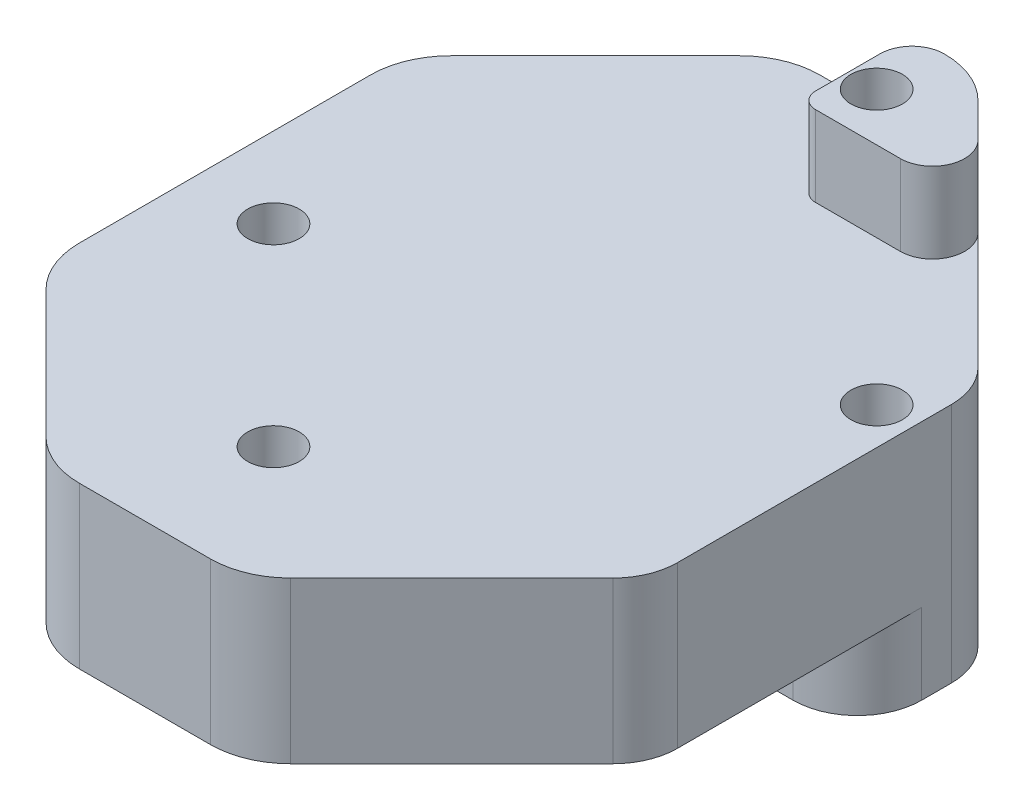
from build123d import *

# Parameters (mm, degrees)
SKETCH_1_R          = 1.6
EXTRUDE_1_DEPTH     = 10
EXTRUDE_START       = 5
SKETCH_2_R          = 1.6
EXTRUDE_2_DEPTH     = 5
SKETCH_3_OUTSIDE_W  = 53.056
SKETCH_3_OUTSIDE_H  = 59.256
CUT_EXTRUDE_1_DEPTH = 46.488899745
FILLET_1_R          = 5
FILLET_2_R          = 2
SKETCH_4_R          = 1.6
EXTRUDE_3_DEPTH     = 5
FILLET_3_R          = 2
CUT_EXTRUDE_START   = -24
CUT_EXTRUDE_2_DEPTH = 24
FILLET_4_R          = 4


with BuildPart() as part:
    # 草图1 → 凸台-拉伸1 (new body)
    with BuildSketch(Plane(origin=(0, 0, 0), x_dir=(1, 0, 0), z_dir=(0, 1, 0))):
        Polygon((6.8, 37), (21.8, 22), (21.8, -8), (-17, -8), (-17, 37), align=None)
        Circle(SKETCH_1_R, mode=Mode.SUBTRACT)
        with Locations((-12, 12)):
            Circle(SKETCH_1_R, mode=Mode.SUBTRACT)
        with Locations((4.5, 33)):
            Circle(SKETCH_1_R, mode=Mode.SUBTRACT)
        with Locations((16.5, 21)):
            Circle(SKETCH_1_R, mode=Mode.SUBTRACT)
    extrude(amount=EXTRUDE_1_DEPTH)

    # 草图2 → 凸台-拉伸2 (add)
    with BuildSketch(Plane.XZ.offset(EXTRUDE_START)):
        with BuildLine():
            Line((21.8, -17.5), (2, -17.5))
            ThreePointArc((2, -17.5), (0.585786438, -18.085786438), (0, -19.5))
            Line((0, -19.5), (0, -37))
            Line((0, -37), (6.8, -37))
            Line((6.8, -37), (21.8, -22))
            Line((21.8, -22), (21.8, -17.5))
        make_face()
        with Locations((4.5, -33)):
            Circle(SKETCH_2_R, mode=Mode.SUBTRACT)
        with Locations((16.5, -21)):
            Circle(SKETCH_2_R, mode=Mode.SUBTRACT)
    extrude(amount=-EXTRUDE_2_DEPTH)

    # 草图3 outside → 切除-拉伸1 (cut, through all)
    with BuildSketch(Plane(origin=(0, 10, 0), x_dir=(1, 0, 0), z_dir=(0, 1, 0))):
        with Locations((2.4, 14.5)):
            Rectangle(SKETCH_3_OUTSIDE_W, SKETCH_3_OUTSIDE_H)
        Polygon((-5.1, 37), (-17, 25.1), (-17, 2.857864376), (-6.142135624, -8), (6.142135624, -8), (21.8, 7.657864376), (21.8, 22), (6.8, 37), align=None, mode=Mode.SUBTRACT)
    extrude(amount=-CUT_EXTRUDE_1_DEPTH, mode=Mode.SUBTRACT)

    # 圆角1
    fillet_1_edges = [part.edges().sort_by_distance(p)[0] for p in [
        (21.8, 5, -7.657864376),
        (6.142135624, 5, 8),
        (-6.142135624, 5, 8),
        (-17, 5, -2.857864376),
        (-17, 5, -25.1),
        (-5.1, 5, -37),
        (21.8, 2.5, -22),
        (6.8, 2.5, -37),
    ]]
    fillet(fillet_1_edges, radius=FILLET_1_R)

    # 圆角2
    fillet_2_edges = [part.edges().sort_by_distance(p)[0] for p in [
        (0, -2.5, -37),
        (21.8, -2.5, -17.5),
    ]]
    fillet(fillet_2_edges, radius=FILLET_2_R)

    # 草图4 → 凸台-拉伸3 (add)
    with BuildSketch(Plane(origin=(0, 10, 0), x_dir=(1, 0, 0), z_dir=(0, 1, 0))):
        with BuildLine():
            Line((2.7, 37), (2.7, 31))
            ThreePointArc((2.7, 31), (2.992893219, 30.292893219), (3.7, 30))
            Line((3.7, 30), (13.8, 30))
            Line((13.8, 30), (8.264466094, 35.535533906))
            ThreePointArc((8.264466094, 35.535533906), (6.64234935, 36.619397663), (4.728932188, 37))
            Line((4.728932188, 37), (2.7, 37))
        make_face()
        with Locations((4.5, 33)):
            Circle(SKETCH_4_R, mode=Mode.SUBTRACT)
    extrude(amount=EXTRUDE_3_DEPTH)

    # 圆角3
    fillet_3_edges = [part.edges().sort_by_distance(p)[0] for p in [
        (2.7, 12.5, -37),
        (13.8, 12.5, -30),
    ]]
    fillet(fillet_3_edges, radius=FILLET_3_R)

    # 草图5 → 切除-拉伸2 (cut)
    with BuildSketch(Plane(origin=(0, 10, 0), x_dir=(1, 0, 0), z_dir=(0, 1, 0)).offset(CUT_EXTRUDE_START)):
        with BuildLine():
            Line((18.8, 25), (18.8, 4.657864376))
            Line((18.8, 4.657864376), (20.335533906, 6.193398282))
            ThreePointArc((20.335533906, 6.193398282), (21.419397663, 7.815515026), (21.8, 9.728932188))
            Line((21.8, 9.728932188), (21.8, 19.928932188))
            ThreePointArc((21.8, 19.928932188), (21.419397663, 21.84234935), (20.335533906, 23.464466094))
            Line((20.335533906, 23.464466094), (18.8, 25))
        make_face()
    extrude(amount=CUT_EXTRUDE_2_DEPTH, mode=Mode.SUBTRACT)

    # 圆角4
    fillet_4_edges = [part.edges().sort_by_distance(p)[0] for p in [
        (18.8, -2.5, -17.5),
        (18.8, 5, -4.657864376),
        (18.8, 2.5, -25),
    ]]
    fillet(fillet_4_edges, radius=FILLET_4_R)


solid = part.part
